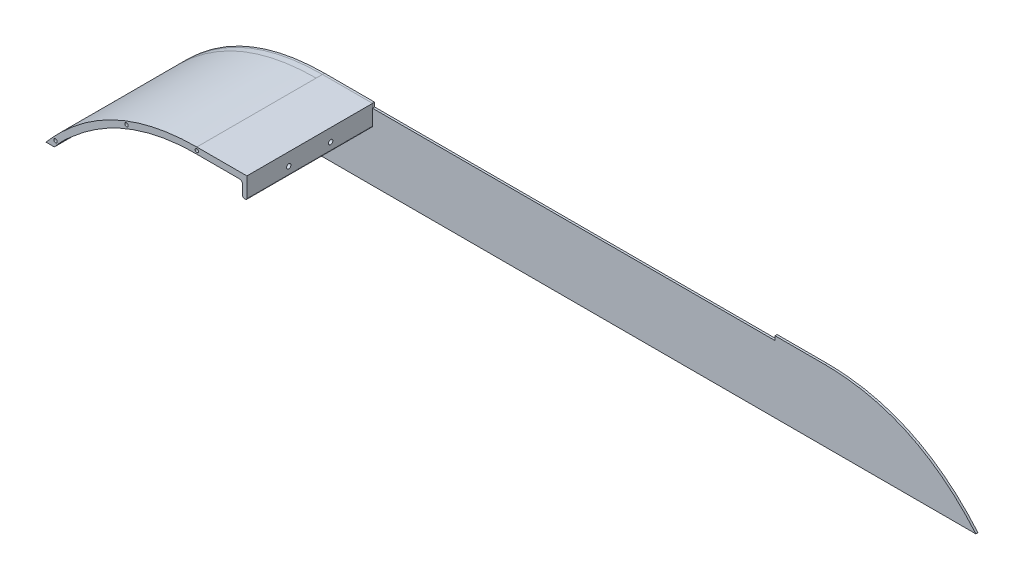
from build123d import *

# Parameters (mm, degrees)
BOSS_EXTRUDE1_DEPTH = 3.175
CUT_EXTRUDE1_DEPTH  = 921.755474233
BOSS_EXTRUDE2_DEPTH = 9.525
BOSS_EXTRUDE3_DEPTH = 180.975
SKETCH6_W           = 28.082698006
SKETCH6_H           = 28.575
CUT_EXTRUDE2_DEPTH  = 9.525
SKETCH7_R           = 3.275
CUT_EXTRUDE3_DEPTH  = 939.366939617
SKETCH8_R           = 3.325
CUT_EXTRUDE5_DEPTH  = 6.35
SKETCH9_R           = 2.6
SKETCH9_R_2         = 2.600000001
CUT_EXTRUDE6_DEPTH  = 12.7
SKETCH11_R          = 1.9
BOSS_EXTRUDE5_DEPTH = 10.16
FILLET1_R           = 5
FILLET2_R           = 2
FILLET3_R           = 1
FILLET4_R           = 2


# Read off the part's stored shape, not the designer's step: Split1
with BuildPart() as part:
    # Sketch1 → Boss-Extrude1 (new body)
    with BuildSketch(Plane.XY):
        with BuildLine():
            Line((0, 0), (-304.8, 0))
            add(Edge.make_bspline(
                [(-304.8, 0), (-213.403997347, 107.359981337), (-76.2, 107.95)],
                knots=[0, 0, 0, 1, 1, 1], degree=2))
            Line((-76.2, 107.95), (0, 107.95))
            Line((0, 107.95), (609.6, 107.95))
            Line((609.6, 107.95), (685.8, 107.95))
            add(Edge.make_bspline(
                [(914.4, 0), (823.003997347, 107.359981337), (685.8, 107.95)],
                knots=[0, 0, 0, 1, 1, 1], degree=2))
            Line((914.4, 0), (609.6, 0))
            Line((609.6, 0), (0, 0))
        make_face()
    extrude(amount=BOSS_EXTRUDE1_DEPTH)

    # Sketch2 → Cut-Extrude1 (cut, through all)
    with BuildSketch(Plane.XY.offset(3.175)):
        Polygon((0, 107.95), (609.6, 107.95), (609.854, 107.95), (609.854, 101.6), (609.6, 101.6), (0, 101.6), (-0.254, 101.6), (-0.254, 107.95), align=None)
    extrude(amount=-CUT_EXTRUDE1_DEPTH, mode=Mode.SUBTRACT)

    # Sketch3 → Boss-Extrude2 (add)
    with BuildSketch(Plane.XY.offset(3.175)):
        with BuildLine():
            Line((-304.8, 0), (-254.508, 0))
            Line((-254.508, 0), (-254.508, 15.344828713))
            add(Edge.make_bspline(
                [(-254.508, 15.344828713), (-177.798332328, 82.893238953), (-76.090773332, 82.550234853)],
                knots=[0, 0, 0, 1, 1, 1], degree=2))
            Line((-76.090773332, 82.550234853), (-6.604, 82.550234853))
            Line((-6.604, 82.550234853), (-6.604, 76.2))
            Line((-6.604, 76.2), (-0.254, 76.2))
            Line((-0.254, 76.2), (-0.254, 107.95))
            Line((-0.254, 107.95), (-76.2, 107.95))
            add(Edge.make_bspline(
                [(-76.2, 107.95), (-213.403997347, 107.359981337), (-304.8, 0)],
                knots=[0, 0, 0, 1, 1, 1], degree=2))
        make_face()
    extrude(amount=BOSS_EXTRUDE2_DEPTH)

    # Sketch5 → Boss-Extrude3 (add)
    with BuildSketch(Plane.XY.offset(12.7)):
        with BuildLine():
            Line((-304.8, 0), (-292.1, 0))
            add(Edge.make_bspline(
                [(-264.999310143, 27.259023461), (-280.043189094, 15.090688978), (-292.1, 0)],
                knots=[0, 0, 0, 1, 1, 1], degree=2))
            add(Edge.make_bspline(
                [(-264.999310143, 27.259023461), (-263.324912471, 28.733451708), (-259.93755133, 31.654735884), (-253.107003874, 37.29977015), (-244.418964995, 44.024448353), (-233.76867915, 51.547177424), (-219.265929961, 60.847632169), (-200.578257731, 71.093058658), (-177.28374589, 81.152323376), (-153.155325898, 88.956116173), (-132.386582303, 93.571898544), (-115.39333326, 96.133277835), (-102.464741628, 97.490056952), (-91.537068573, 98.151901873), (-82.713415498, 98.401217113), (-78.259134389, 98.432637828), (-76.037235922, 98.425144577)],
                knots=[0.49783188, 0.49783188, 0.49783188, 0.49783188, 0.497964782, 0.498097684, 0.498363488, 0.498629292, 0.498895096, 0.499426703, 0.499958311, 0.500489919, 0.501021527, 0.501287331, 0.501553135, 0.501818938, 0.50195184, 0.502084742, 0.502084742, 0.502084742, 0.502084742], degree=3))
            Line((-76.037235922, 98.425144577), (-6.604, 98.425144577))
            Line((-6.604, 98.425144577), (-6.604, 82.550234853))
            Line((-6.604, 82.550234853), (-6.604, 76.2))
            Line((-6.604, 76.2), (-0.254, 76.2))
            Line((-0.254, 76.2), (-0.254, 107.95))
            Line((-0.254, 107.95), (-76.199999999, 107.95))
            add(Edge.make_bspline(
                [(-76.199999999, 107.95), (-213.403997347, 107.359981337), (-304.8, 0)],
                knots=[0, 0, 0, 1, 1, 1], degree=2))
        make_face()
    extrude(amount=BOSS_EXTRUDE3_DEPTH)

    # Sketch6 → Cut-Extrude2 (cut)
    with BuildSketch(Plane.XY.offset(12.7)):
        with Locations((-240.466650997, 14.2875)):
            Rectangle(SKETCH6_W, SKETCH6_H)
    extrude(amount=-CUT_EXTRUDE2_DEPTH, mode=Mode.SUBTRACT)

    # Sketch7 → Cut-Extrude3 (cut, through all)
    with BuildSketch(Plane.XY.offset(12.7)):
        with Locations((-267.208, 10.16)):
            Circle(SKETCH7_R)
        with Locations((-175.365808452, 72.622269579)):
            Circle(SKETCH7_R)
        with Locations((-57.404, 90.17019152)):
            Circle(SKETCH7_R)
    extrude(amount=-CUT_EXTRUDE3_DEPTH, mode=Mode.SUBTRACT)

    # Sketch8 → Cut-Extrude5 (cut)
    with BuildSketch(Plane(origin=(-0.254, 0, 0), x_dir=(0, 0, -1), z_dir=(1, 0, 0))):
        with Locations((-66.675, 88.9)):
            Circle(SKETCH8_R)
        with Locations((-130.175, 88.9)):
            Circle(SKETCH8_R)
    extrude(amount=-CUT_EXTRUDE5_DEPTH, mode=Mode.SUBTRACT)

    # Sketch9 → Cut-Extrude6 (cut)
    with BuildSketch(Plane.XY.offset(193.675)):
        with Locations((-290.370830702, 9.142552388)):
            Circle(SKETCH9_R)
        with Locations((-182.759356376, 83.816480509)):
            Circle(SKETCH9_R)
        with Locations((-76.179788765, 103.250043457)):
            Circle(SKETCH9_R_2)
    extrude(amount=-CUT_EXTRUDE6_DEPTH, mode=Mode.SUBTRACT)

    # Sketch11 → Boss-Extrude5 (add)
    with BuildSketch(Plane(origin=(-254.508, 2e-09, 0), x_dir=(0, 0, -1), z_dir=(1.0, -6.037741648177811e-12, 0))):
        with Locations(Location((-7.1374, 3.975099998, 0), (0, 0, 270))):
            Circle(SKETCH11_R)
        with Locations(Location((-7.1374, 21.425099998, 0), (0, 0, 270))):
            Circle(SKETCH11_R)
    extrude(amount=BOSS_EXTRUDE5_DEPTH)

    # Fillet1
    fillet1_edges = [part.edges().sort_by_distance(p)[0] for p in [
        (-6.604, 98.425144577, 103.1875),
    ]]
    fillet(fillet1_edges, radius=FILLET1_R)

    # Fillet2
    fillet2_edges = [part.edges().sort_by_distance(p)[0] for p in [
        (-238.394170448, 28.575, 7.9375),
        (-254.508, 28.575, 7.9375),
    ]]
    fillet(fillet2_edges, radius=FILLET2_R)

    # Fillet3
    # the kernel refuses this fillet: 1 mm, written as the material it takes off along each edge
    with BuildSketch(Plane(origin=(-292.1, 0, 12.7), x_dir=(0.6252400597778598, 0.7804324875663354, 0), z_dir=(0, 0, 1))) as fillet3_piece_1:
        with BuildLine():
            CenterArc((0.480195921, 0.999999109), FILLET3_R, 218.699809372, 51.223710378)
            Line((-0.300236566, 0.374759049), (-0.315845216, 0.362254248))
            Line((-0.315845216, 0.362254248), (-0.01560865, -0.012504801))
            Line((-0.01560865, -0.012504801), (2.669e-05, -0.019999982))
            ThreePointArc((2.669e-05, -0.019999982), (0.239430546, -0.019840221), (0.478834393, -0.019999982))
            Line((0.478834393, -0.019999982), (0.478861089, 0))
        make_face()
    extrude(amount=180.975, mode=Mode.SUBTRACT)

    # Fillet4
    fillet4_edges = [part.edges().sort_by_distance(p)[0] for p in [
        (-6.604, 82.550234853, 7.9375),
        (-6.604, 76.2, 98.425),
        (-0.254, 76.2, 98.425),
    ]]
    fillet(fillet4_edges, radius=FILLET4_R)


with BuildPart() as body_2:
    # Split1: the piece on the far side of the plane
    add(part.part)
    split(bisect_by=Plane.XY.offset(3.175), keep=Keep.BOTTOM)


with BuildPart() as part_1:
    add(part.part)

    # Split1
    split(bisect_by=Plane.XY.offset(3.175), keep=Keep.TOP)


solid = Compound([body_2.part, part_1.part])
